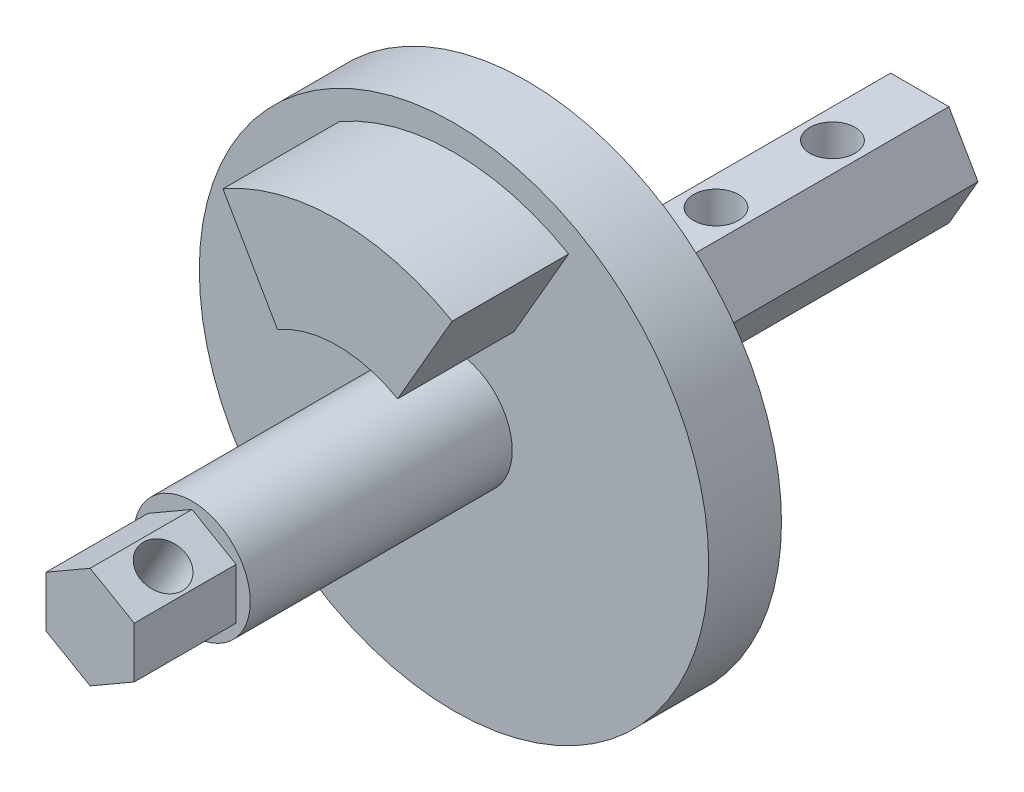
from build123d import *

# Parameters (mm, degrees)
SKETCH1_R           = 17.5
BOSS_EXTRUDE1_DEPTH = 2.5
BOSS_EXTRUDE2_DEPTH = 8
SKETCH3_R           = 4
BOSS_EXTRUDE3_DEPTH = 18
BOSS_EXTRUDE4_START = 7
SKETCH7_R           = 4
BOSS_EXTRUDE4_DEPTH = 7
BOSS_EXTRUDE5_DEPTH = 20
SKETCH10_R          = 1.55
CUT_EXTRUDE1_DEPTH  = 7
BOSS_EXTRUDE6_DEPTH = 7
SKETCH12_R          = 1.55
CUT_EXTRUDE2_DEPTH  = 6.1


with BuildPart() as part:
    # Sketch1 → Boss-Extrude1 (new, symmetric)
    with BuildSketch(Plane.XY):
        Circle(SKETCH1_R)
    extrude(amount=BOSS_EXTRUDE1_DEPTH, both=True)

    # Sketch2 → Boss-Extrude2 (add)
    with BuildSketch(Plane.XY.offset(2.5)):
        with BuildLine():
            Line((7.875, 13.63990011), (4.125, 7.144709581))
            ThreePointArc((4.125, 7.144709581), (0, 8.25), (-4.125, 7.144709581))
            Line((-4.125, 7.144709581), (-7.875, 13.63990011))
            ThreePointArc((-7.875, 13.63990011), (0, 15.75), (7.875, 13.63990011))
        make_face()
    extrude(amount=BOSS_EXTRUDE2_DEPTH)

    # Sketch3 → Boss-Extrude3 (add)
    with BuildSketch(Plane.XY.offset(2.5)):
        Circle(SKETCH3_R)
    extrude(amount=BOSS_EXTRUDE3_DEPTH)

    # Sketch7 → Boss-Extrude4 (add)
    with BuildSketch(Plane(origin=(0, 0, -2.5), x_dir=(-1, 0, 0), z_dir=(0, 0, -1)).offset(BOSS_EXTRUDE4_START)):
        Circle(SKETCH7_R)
    extrude(amount=-BOSS_EXTRUDE4_DEPTH)

    # Sketch9 → Boss-Extrude5 (add)
    with BuildSketch(Plane(origin=(0, 0, -9.5), x_dir=(-1, 0, 0), z_dir=(0, 0, -1))):
        Polygon((4, 0), (2, 3.464101615), (-2, 3.464101615), (-4, 0), (-2, -3.464101615), (2, -3.464101615), align=None)
    extrude(amount=BOSS_EXTRUDE5_DEPTH)

    # Sketch10 → Cut-Extrude1 (cut)
    with BuildSketch(Plane(origin=(0, -3.464101615, 0), x_dir=(-1, 0, 0), z_dir=(0, 1, 0))):
        with Locations((0, -23.5)):
            Circle(SKETCH10_R)
        with Locations((0, -15.5)):
            Circle(SKETCH10_R)
    extrude(amount=CUT_EXTRUDE1_DEPTH, mode=Mode.SUBTRACT)

    # Sketch11 → Boss-Extrude6 (add)
    with BuildSketch(Plane.XY.offset(20.5)):
        Polygon((3.031088913, 1.75), (0, 3.5), (-3.031088913, 1.75), (-3.031088913, -1.75), (0, -3.5), (3.031088913, -1.75), align=None)
    extrude(amount=BOSS_EXTRUDE6_DEPTH)

    # Sketch12 → Cut-Extrude2 (cut)
    with BuildSketch(Plane(origin=(-1.515544457, -2.625, 0), x_dir=(0.8660254037844372, -0.5000000000000026, 0), z_dir=(-0.5000000000000026, -0.8660254037844372, 0))):
        with Locations((0, 24)):
            Circle(SKETCH12_R)
    extrude(amount=-CUT_EXTRUDE2_DEPTH, mode=Mode.SUBTRACT)


solid = part.part
